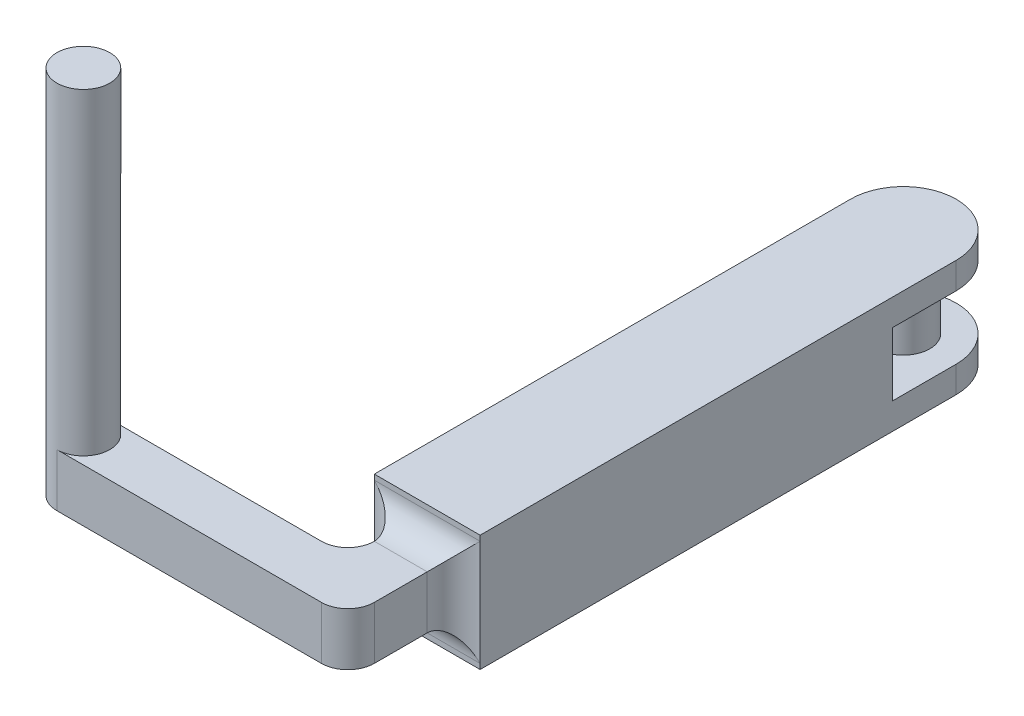
from build123d import *

# Parameters (mm, degrees)
SKETCH1_R                = 3.175
BOSS_EXTRUDE1_DEPTH      = 38.1
BOSS_EXTRUDE2_DEPTH      = 6.35
FILLET1_R                = 3.175
BOSS_EXTRUDE3_DEPTH      = 3.81
BOSS_EXTRUDE3_DEPTH_BACK = 10.16
SKETCH3_W                = 12.7
SKETCH3_H                = 63.5
FILLET2_R                = 3.175
FILLET3_R                = 6.35
CUT_EXTRUDE1_REACH       = 94.13
SKETCH4_W                = 15.24
SKETCH4_H                = 7.62
SKETCH5_R                = 3.175
BOSS_EXTRUDE4_DEPTH      = 10.16
BOSS_EXTRUDE5_START      = 38.1
SKETCH6_R                = 3.175
BOSS_EXTRUDE5_DEPTH      = 38.1
SKETCH7_R                = 3.175
CUT_EXTRUDE2_DEPTH       = 38.1


with BuildPart() as part:
    # Sketch1 → Boss-Extrude1 (new body)
    with BuildSketch(Plane(origin=(0, 0, 0), x_dir=(1, 0, 0), z_dir=(0, 1, 0))):
        with Locations(Location((0, 0, 0), (0, 0, 270))):
            Circle(SKETCH1_R)
    extrude(amount=-BOSS_EXTRUDE1_DEPTH)

    # Sketch2 → Boss-Extrude2 (add)
    with BuildSketch(Plane(origin=(0, 0, 0), x_dir=(1, 0, 0), z_dir=(0, 1, 0))):
        Polygon((34.925, -3.175), (-3.175, -3.175), (-3.175, 3.175), (28.575, 3.175), (28.575, 60.325), (34.925, 60.325), align=None)
    extrude(amount=BOSS_EXTRUDE2_DEPTH)

    # Fillet1
    fillet1_edges = [part.edges().sort_by_distance(p)[0] for p in [
        (28.575, 3.175, -3.175),
        (34.925, 3.175, 3.175),
        (-3.175, 3.175, -3.175),
        (-3.175, 3.175, 3.175),
    ]]
    fillet(fillet1_edges, radius=FILLET1_R - 0.0001)  # a hair under: the kernel refuses the full size

    # Sketch3 → Boss-Extrude3 (add, two sides: drawn at the far end of the back side and taken through both)
    with BuildSketch(Plane(origin=(0, 6.35, 0), x_dir=(1, 0, 0), z_dir=(0, 1, 0)).offset(-BOSS_EXTRUDE3_DEPTH_BACK)):
        with Locations((31.75, 41.275)):
            Rectangle(SKETCH3_W, SKETCH3_H)
    extrude(amount=BOSS_EXTRUDE3_DEPTH + BOSS_EXTRUDE3_DEPTH_BACK)

    # Fillet2
    fillet2_edges = [part.edges().sort_by_distance(p)[0] for p in [
        (28.575, 3.175, -9.525),
        (31.75, 0, -9.525),
        (34.925, 3.175, -9.525),
        (31.75, 6.35, -9.525),
    ]]
    fillet(fillet2_edges, radius=FILLET2_R - 0.0001)  # a hair under: the kernel refuses the full size

    # Fillet3
    fillet3_edges = [part.edges().sort_by_distance(p)[0] for p in [
        (25.4, 3.175, -73.025),
        (38.1, 3.175, -73.025),
    ]]
    fillet(fillet3_edges, radius=FILLET3_R - 0.0001)  # a hair under: the kernel refuses the full size

    # Sketch4 → Cut-Extrude1 (cut, up to next)
    with BuildSketch(Plane(origin=(38.1, 0, 0), x_dir=(0, 0, -1), z_dir=(1, 0, 0)), mode=Mode.PRIVATE) as cut_extrude1_sk1:
        with Locations((66.675, 3.175)):
            Rectangle(SKETCH4_W, SKETCH4_H)
    cut_extrude1_tool1 = extrude(cut_extrude1_sk1.sketch, amount=-CUT_EXTRUDE1_REACH, mode=Mode.PRIVATE) & part.part
    add(cut_extrude1_tool1.solids().sort_by_distance((38.1, 3.175, -66.675))[0], mode=Mode.SUBTRACT)

    # Sketch5 → Boss-Extrude4 (add)
    with BuildSketch(Plane(origin=(0, -0.635, 0), x_dir=(1, 0, 0), z_dir=(0, 1, 0))):
        with Locations(Location((31.75, 66.675, 0), (0, 0, 90))):
            Circle(SKETCH5_R)
    extrude(amount=BOSS_EXTRUDE4_DEPTH)

    # Sketch6 → Boss-Extrude5 (add)
    with BuildSketch(Plane(origin=(0, 6.35, 0), x_dir=(1, 0, 0), z_dir=(0, 1, 0)).offset(BOSS_EXTRUDE5_START)):
        with Locations(Location((0, 0, 0), (0, 0, 270))):
            Circle(SKETCH6_R)
    extrude(amount=-BOSS_EXTRUDE5_DEPTH)

    # Sketch7 → Cut-Extrude2 (cut)
    with BuildSketch(Plane.XZ):
        with Locations(Location((0, 0, 0), (0, 0, 90))):
            Circle(SKETCH7_R)
    extrude(amount=CUT_EXTRUDE2_DEPTH, mode=Mode.SUBTRACT)


with BuildPart() as cut_extrude2_kept_piece:
    # of the separate pieces the step leaves, the one the design keeps (cut_extrude2_pieces_kept)
    add(part.part.solids().sort_by_distance((25.4, 10.16, -66.6751))[0])


solid = cut_extrude2_kept_piece.part
